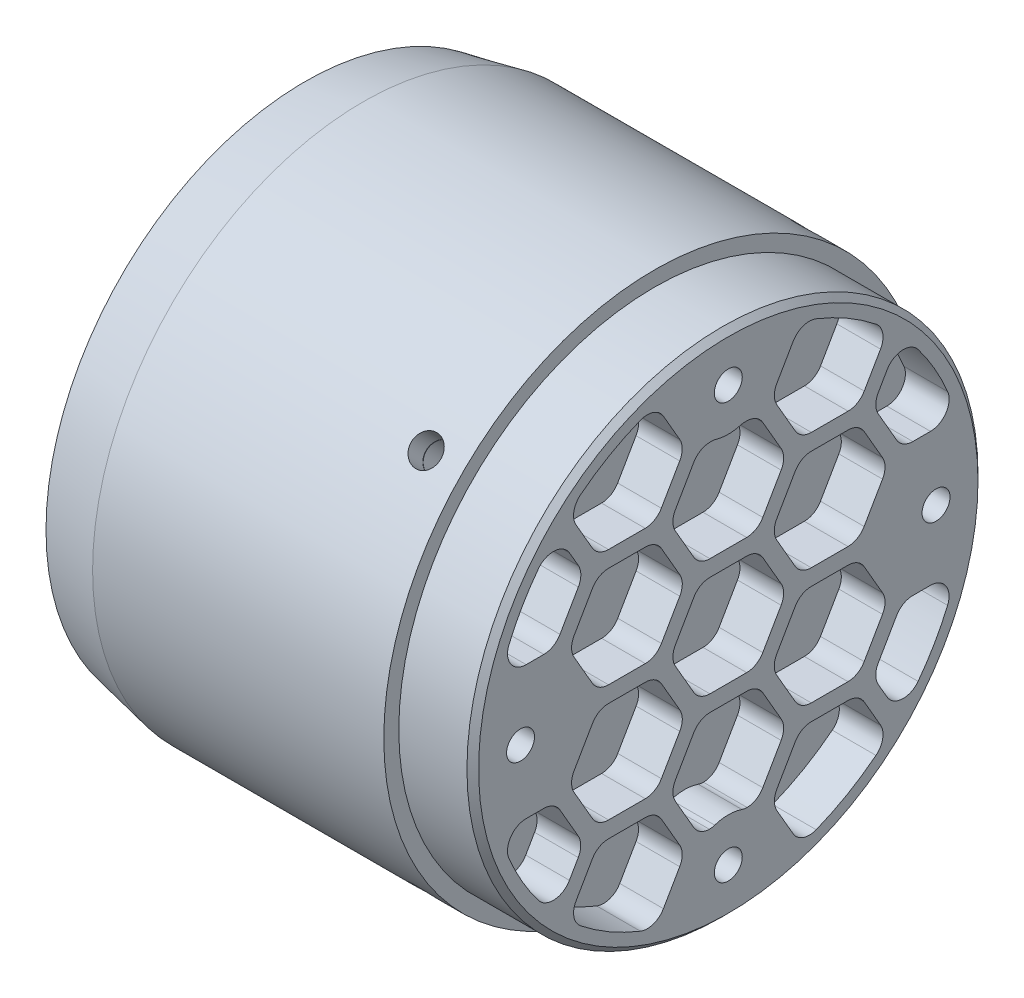
from build123d import *

# Parameters (mm, degrees)
SKETCH2_W               = 12.7
SKETCH2_H               = 14.195
SKETCH3_R               = 2.45
CUT_EXTRUDE1_DEPTH      = 89.967437864
CUT_EXTRUDE2_REACH      = 129.183
CUT_EXTRUDE2_END_RADIUS = 28.575
SKETCH4_R               = 2.54
CIRPATTERN1_COUNT       = 4
CUT_EXTRUDE3_DEPTH      = 12.7
FILLET1_R               = 3.2
FILLET2_R               = 3.2
SKETCH6_R               = 43.875
SKETCH6_R_2             = 2.4
BOSS_EXTRUDE1_DEPTH     = 12.7
CHAMFER1_SIZE           = 1
CUT_EXTRUDE4_DEPTH      = 7.5
FILLET3_R               = 3.2
FILLET4_START           = 65.2
FILLET4_DEPTH           = 7.5


with BuildPart() as part:
    # Sketch1 → Revolve1 (revolve)
    with BuildSketch(Plane.XY, mode=Mode.PRIVATE) as revolve1_sk:
        Polygon((10, 46.45), (60, 46.45), (60, 44.45), (60, 42.85), (40, 42.85), (40, 44.45), (0, 44.45), align=None)
    revolve(revolve1_sk.sketch.rotate(Axis((0, 0, 0), (1, 0, 0)), 90), axis=Axis((0, 0, 0), (1, 0, 0)))


with BuildPart() as body_2:
    # Sketch2 → Revolve2 (revolve)
    with BuildSketch(Plane.XY, mode=Mode.PRIVATE) as revolve2_sk:
        with Locations((53.65, 35.6725)):
            Rectangle(SKETCH2_W, SKETCH2_H)
    revolve(revolve2_sk.sketch.rotate(Axis((0, 0, 0), (1, 0, 0)), 90), axis=Axis((0, 0, 0), (1, 0, 0)))

    # Sketch3 → Cut-Extrude1 (cut, through all)
    with BuildSketch(Plane(origin=(60, 0, 0), x_dir=(0, 0, -1), z_dir=(1, 0, 0))):
        with Locations((-35.6725, 0)):
            Circle(SKETCH3_R)
        with Locations((0, 35.6725)):
            Circle(SKETCH3_R)
        with Locations((35.6725, 0)):
            Circle(SKETCH3_R)
        with Locations((0, -35.6725)):
            Circle(SKETCH3_R)
    extrude(amount=-CUT_EXTRUDE1_DEPTH, mode=Mode.SUBTRACT)


with BuildPart() as cut_extrude2_tool:
    # Cut-Extrude2: up to this cylinder (the profile starts outside it)
    cut_extrude2_end = Plane(origin=(53.65, 0, 0), z_dir=(-1, 0, 0)) * Cylinder(CUT_EXTRUDE2_END_RADIUS, 316.516, mode=Mode.PRIVATE)
    # Sketch4 → Cut-Extrude2 (new, up to the surface)
    with BuildSketch(Plane(origin=(0, 32.845109986, 32.845109986), x_dir=(-1, 0, 0), z_dir=(0, 0.7071067811865464, 0.7071067811865488)), mode=Mode.PRIVATE) as cut_extrude2_sk1:
        with Locations(Location((-53.65, 0, 0), (0, 0, 90))):
            Circle(SKETCH4_R)
    cut_extrude2_tool1 = extrude(cut_extrude2_sk1.sketch, amount=-CUT_EXTRUDE2_REACH, mode=Mode.PRIVATE) - cut_extrude2_end
    cut_extrude2 = cut_extrude2_tool1.solids().sort_by_distance((53.65, 32.84511, 32.84511))[0]
    add(cut_extrude2)


with BuildPart() as part_1:
    add(part.part)

    # Cut-Extrude2: cut by cut_extrude2_tool
    add(cut_extrude2_tool.part, mode=Mode.SUBTRACT)


with BuildPart() as body_2_1:
    add(body_2.part)

    # Cut-Extrude2: cut by cut_extrude2_tool
    add(cut_extrude2_tool.part, mode=Mode.SUBTRACT)


with BuildPart() as cirpattern1_tool:
    # CirPattern1: Cut-Extrude2 ×4 about axis
    cirpattern1_axis = Axis((60, 0, 0), (-1, 0, 0))
    for i in range(1, CIRPATTERN1_COUNT):
        add(cut_extrude2.rotate(cirpattern1_axis, i * 360 / CIRPATTERN1_COUNT))


with BuildPart() as part_2:
    add(part_1.part)

    # CirPattern1: cut by cirpattern1_tool
    add(cirpattern1_tool.part, mode=Mode.SUBTRACT)

    # Fillet2
    # the kernel refuses this fillet: 3.2 mm, written as the material it adds along each edge
    with BuildSketch(Plane(origin=(40, 0, 0), x_dir=(0, 0, 1), z_dir=(0, 1, 0))) as fillet2_piece_1:
        with BuildLine():
            CenterArc((41.25, -2.771281292), FILLET2_R, 0, 60)
            Line((44.45, -2.771281292), (44.514, -2.771281292))
            Line((44.514, -2.771281292), (44.514, 0))
            Line((44.514, 0), (44.45, 0.064))
            ThreePointArc((44.45, 0.064), (43.65, 0.064), (42.882, 0.055425626))
            Line((42.882, 0.055425626), (42.85, 0))
        make_face()
    revolve(axis=Axis((40, 0, 0), (1, 0, 0)))


with BuildPart() as body_2_2:
    add(body_2_1.part)

    # CirPattern1: cut by cirpattern1_tool
    add(cirpattern1_tool.part, mode=Mode.SUBTRACT)

    # Sketch5 → Cut-Extrude3 (cut)
    with BuildSketch(Plane(origin=(60, 0, 0), x_dir=(0, 0, -1), z_dir=(1, 0, 0))):
        Polygon((-29.044411037, 18.437809319), (-18.437809319, 29.044411037), (-11.366741508, 21.973343225), (-21.973343225, 11.366741508), align=None)
    extrude(amount=-CUT_EXTRUDE3_DEPTH, mode=Mode.SUBTRACT)

    # Fillet1
    fillet1_edges = [body_2_2.edges().sort_by_distance(p)[0] for p in [
        (53.65, 14.193886438, 24.800488156),
        (53.65, 24.800488156, 14.193886438),
        (53.65, 29.044411037, 18.437809319),
        (53.65, 18.437809319, 29.044411037),
    ]]
    fillet(fillet1_edges, radius=FILLET1_R)


with BuildPart() as body_3:
    # Sketch6 → Boss-Extrude1 (new body)
    with BuildSketch(Plane(origin=(60, 0, 0), x_dir=(0, 0, -1), z_dir=(1, 0, 0))):
        Circle(SKETCH6_R)
        with Locations((0, 35.6725)):
            Circle(SKETCH6_R_2, mode=Mode.SUBTRACT)
        with Locations((35.6725, 0)):
            Circle(SKETCH6_R_2, mode=Mode.SUBTRACT)
        with Locations((0, -35.6725)):
            Circle(SKETCH6_R_2, mode=Mode.SUBTRACT)
        with Locations((-35.6725, 0)):
            Circle(SKETCH6_R_2, mode=Mode.SUBTRACT)
    extrude(amount=BOSS_EXTRUDE1_DEPTH)

    # Chamfer1
    chamfer1_edges = [body_3.edges().sort_by_distance(p)[0] for p in [
        (72.7, 0, 43.875),
    ]]
    chamfer(chamfer1_edges, length=CHAMFER1_SIZE)

    # Sketch7 → Cut-Extrude4 (cut)
    with BuildSketch(Plane(origin=(72.7, 0, 0), x_dir=(0, 0, -1), z_dir=(1, 0, 0))):
        with BuildLine():
            Line((5, 11.437286527), (10, 20.097540565))
            Line((10, 20.097540565), (5, 28.757794602))
            Line((5, 28.757794602), (2.403232968, 28.757794602))
            ThreePointArc((2.403232968, 28.757794602), (0, 28.359529942), (-2.403232968, 28.757794602))
            Line((-2.403232968, 28.757794602), (-5, 28.757794602))
            Line((-5, 28.757794602), (-10, 20.097540565))
            Line((-10, 20.097540565), (-5, 11.437286527))
            Line((-5, 11.437286527), (5, 11.437286527))
        make_face()
        with BuildLine():
            ThreePointArc((27.243141885, 30.472558889), (20.4375, 35.39878838), (12.768439173, 38.829532396))
            Line((12.768439173, 38.829532396), (12.418240981, 38.829532396))
            Line((12.418240981, 38.829532396), (7.418240981, 30.169278358))
            Line((7.418240981, 30.169278358), (12.418240981, 21.50902432))
            Line((12.418240981, 21.50902432), (22.418240981, 21.50902432))
            Line((22.418240981, 21.50902432), (27.418240981, 30.169278358))
            Line((27.418240981, 30.169278358), (27.243141885, 30.472558889))
        make_face()
        with BuildLine():
            Line((-12.418240981, 38.829532396), (-12.768439173, 38.829532396))
            ThreePointArc((-12.768439173, 38.829532396), (-20.4375, 35.39878838), (-27.243141885, 30.472558889))
            Line((-27.243141885, 30.472558889), (-27.418240981, 30.169278358))
            Line((-27.418240981, 30.169278358), (-22.418240981, 21.50902432))
            Line((-22.418240981, 21.50902432), (-12.418240981, 21.50902432))
            Line((-12.418240981, 21.50902432), (-7.418240981, 30.169278358))
            Line((-7.418240981, 30.169278358), (-12.418240981, 38.829532396))
        make_face()
        with BuildLine():
            ThreePointArc((39.24224894, 11.437286527), (35.404768154, 20.427139226), (29.542644975, 28.24885401))
            Line((29.542644975, 28.24885401), (24.836481962, 20.097540565))
            Line((24.836481962, 20.097540565), (29.836481962, 11.437286527))
            Line((29.836481962, 11.437286527), (39.24224894, 11.437286527))
        make_face()
        with BuildLine():
            Line((-24.823221664, 20.120508076), (-29.526105153, 28.266141221))
            ThreePointArc((-29.526105153, 28.266141221), (-35.392805573, 20.447859024), (-39.235547688, 11.460254038))
            Line((-39.235547688, 11.460254038), (-29.823221664, 11.460254038))
            Line((-29.823221664, 11.460254038), (-24.823221664, 20.120508076))
        make_face()
        with BuildLine():
            ThreePointArc((29.526105153, -28.266141221), (35.392805573, -20.447859024), (39.235547688, -11.460254038))
            Line((39.235547688, -11.460254038), (29.823221664, -11.460254038))
            Line((29.823221664, -11.460254038), (24.823221664, -20.120508076))
            Line((24.823221664, -20.120508076), (29.526105153, -28.266141221))
        make_face()
        with BuildLine():
            Line((-29.836481962, -11.437286527), (-39.24224894, -11.437286527))
            ThreePointArc((-39.24224894, -11.437286527), (-35.404768154, -20.427139226), (-29.542644975, -28.24885401))
            Line((-29.542644975, -28.24885401), (-24.836481962, -20.097540565))
            Line((-24.836481962, -20.097540565), (-29.836481962, -11.437286527))
        make_face()
        with BuildLine():
            ThreePointArc((12.768439173, -38.829532396), (20.4375, -35.39878838), (27.243141885, -30.472558889))
            Line((27.243141885, -30.472558889), (27.418240981, -30.169278358))
            Line((27.418240981, -30.169278358), (22.418240981, -21.50902432))
            Line((22.418240981, -21.50902432), (12.418240981, -21.50902432))
            Line((12.418240981, -21.50902432), (7.418240981, -30.169278358))
            Line((7.418240981, -30.169278358), (12.418240981, -38.829532396))
            Line((12.418240981, -38.829532396), (12.768439173, -38.829532396))
        make_face()
        with BuildLine():
            Line((-27.418240981, -30.169278358), (-27.243141885, -30.472558889))
            ThreePointArc((-27.243141885, -30.472558889), (-20.4375, -35.39878838), (-12.768439173, -38.829532396))
            Line((-12.768439173, -38.829532396), (-12.418240981, -38.829532396))
            Line((-12.418240981, -38.829532396), (-7.418240981, -30.169278358))
            Line((-7.418240981, -30.169278358), (-12.418240981, -21.50902432))
            Line((-12.418240981, -21.50902432), (-22.418240981, -21.50902432))
            Line((-22.418240981, -21.50902432), (-27.418240981, -30.169278358))
        make_face()
        with BuildLine():
            Line((-5, -28.757794602), (-2.772967592, -28.757794602))
            ThreePointArc((-2.772967592, -28.757794602), (0, -28.2225), (2.772967592, -28.757794602))
            Line((2.772967592, -28.757794602), (5, -28.757794602))
            Line((5, -28.757794602), (10, -20.097540565))
            Line((10, -20.097540565), (5, -11.437286527))
            Line((5, -11.437286527), (-5, -11.437286527))
            Line((-5, -11.437286527), (-10, -20.097540565))
            Line((-10, -20.097540565), (-5, -28.757794602))
        make_face()
        Polygon((5, -8.660254038), (10, 0), (5, 8.660254038), (-5, 8.660254038), (-10, 0), (-5, -8.660254038), align=None)
        Polygon((12.404980682, 1.388516244), (22.404980682, 1.388516244), (27.404980682, 10.048770282), (22.404980682, 18.70902432), (12.404980682, 18.70902432), (7.404980682, 10.048770282), align=None)
        Polygon((7.404980682, -10.048770282), (12.404980682, -18.70902432), (22.404980682, -18.70902432), (27.404980682, -10.048770282), (22.404980682, -1.388516244), (12.404980682, -1.388516244), align=None)
        Polygon((-12.404980682, -1.388516244), (-22.404980682, -1.388516244), (-27.404980682, -10.048770282), (-22.404980682, -18.70902432), (-12.404980682, -18.70902432), (-7.404980682, -10.048770282), align=None)
        Polygon((-7.404980682, 10.048770282), (-12.404980682, 18.70902432), (-22.404980682, 18.70902432), (-27.404980682, 10.048770282), (-22.404980682, 1.388516244), (-12.404980682, 1.388516244), align=None)
    extrude(amount=-CUT_EXTRUDE4_DEPTH, mode=Mode.SUBTRACT)

    # Fillet3
    # the kernel refuses this fillet: 3.2 mm, written as the material it adds along each edge
    with BuildSketch(Plane(origin=(72.7, 11.437286527, -39.24224894), x_dir=(0, 0.942317571083779, 0.3347201745141261), z_dir=(-1, 0, 0)), Plane(origin=(72.7, -28.266141221, -29.526105153), x_dir=(0, 0.7610349598303124, -0.6487108677339039), z_dir=(-1, 0, 0)), Plane(origin=(72.7, 28.266141221, 29.526105153), x_dir=(0, -0.7610349598303043, 0.6487108677339136), z_dir=(-1, 0, 0))) as fillet3_piece_1:
        with BuildLine():
            CenterArc((4.530660908, -3.194672636), FILLET3_R, 86.693419498, 112.862103307)
            Line((1.515244681, -4.265777194), (1.454936356, -4.287199286))
            Line((1.454936356, -4.287199286), (-0.060308325, -0.021422091))
            Line((-0.060308325, -0.021422091), (-0.003691436, 0.063893453))
            ThreePointArc((-0.003691436, 0.063893453), (2.357616354, 0.132048752), (4.718924144, 0.063893453))
            Line((4.718924144, 0.063893453), (4.715232708, 0))
        make_face()
    extrude(amount=7.5)
    with BuildSketch(Plane(origin=(72.7, 28.24885401, -29.542644975), x_dir=(0, -0.761439287216753, -0.6482362315412825), z_dir=(-1, 0, 0)), Plane(origin=(72.7, -11.460254038, -39.235547688), x_dir=(0, -0.9421086877765903, 0.3353076503986617), z_dir=(-1, 0, 0)), Plane(origin=(72.7, -28.24885401, 29.542644975), x_dir=(0, 0.7614392872167106, 0.648236231541332), z_dir=(-1, 0, 0)), Plane(origin=(72.7, 11.460254038, 39.235547688), x_dir=(0, 0.9421086877766495, -0.33530765039849575), z_dir=(-1, 0, 0))) as fillet3_piece_2:
        with BuildLine():
            CenterArc((4.533655052, 3.194665586), FILLET3_R, 160.408752913, 112.900015215)
            Line((1.518907251, 4.267650068), (1.458612295, 4.289109757))
            Line((1.458612295, 4.289109757), (-0.060294956, 0.02145969))
            Line((-0.060294956, 0.02145969), (-0.003693876, -0.063893312))
            ThreePointArc((-0.003693876, -0.063893312), (2.359174414, -0.132138799), (4.722042704, -0.063893312))
            Line((4.722042704, -0.063893312), (4.718348828, 0))
        make_face()
    extrude(amount=7.5)
    with BuildSketch(Plane(origin=(72.7, 20.097540565, -24.836481962), x_dir=(0, 0.8660254037844372, -0.5000000000000026), z_dir=(-1, 0, 0)), Plane(origin=(72.7, 11.437286527, -29.836481962), x_dir=(0, 0.8660254037844387, 0.4999999999999999), z_dir=(-1, 0, 0)), Plane(origin=(72.7, 21.50902432, -22.418240981), x_dir=(0, 0, 1), z_dir=(-1, 0, 0)), Plane(origin=(72.7, 21.50902432, -12.418240981), x_dir=(0, 0.8660254037844374, 0.5000000000000021), z_dir=(-1, 0, 0)), Plane(origin=(72.7, 30.169278358, -7.418240981), x_dir=(0, 0.8660254037844403, -0.4999999999999973), z_dir=(-1, 0, 0)), Plane(origin=(72.7, 1.388516244, -22.404980682), x_dir=(0, 0, 1), z_dir=(-1, 0, 0)), Plane(origin=(72.7, 10.048770282, -27.404980682), x_dir=(0, -0.8660254037844374, 0.5000000000000024), z_dir=(-1, 0, 0)), Plane(origin=(72.7, 18.70902432, -22.404980682), x_dir=(0, -0.8660254037844399, -0.4999999999999976), z_dir=(-1, 0, 0)), Plane(origin=(72.7, 18.70902432, -12.404980682), x_dir=(0, 0, -1), z_dir=(-1, 0, 0)), Plane(origin=(72.7, 10.048770282, -7.404980682), x_dir=(0, 0.8660254037844374, -0.5000000000000021), z_dir=(-1, 0, 0)), Plane(origin=(72.7, -10.048770282, -27.404980682), x_dir=(0, -0.866025403784439, 0.4999999999999995), z_dir=(-1, 0, 0)), Plane(origin=(72.7, -1.388516244, -12.404980682), x_dir=(0, 0, -1), z_dir=(-1, 0, 0)), Plane(origin=(72.7, -10.048770282, -7.404980682), x_dir=(0, 0.8660254037844382, -0.500000000000001), z_dir=(-1, 0, 0)), Plane(origin=(72.7, -18.70902432, -22.404980682), x_dir=(0, 0, 1), z_dir=(-1, 0, 0)), Plane(origin=(72.7, -18.70902432, -12.404980682), x_dir=(0, 0.8660254037844383, 0.5000000000000006), z_dir=(-1, 0, 0)), Plane(origin=(72.7, -11.460254038, -29.823221664), x_dir=(0, 0, -1), z_dir=(-1, 0, 0)), Plane(origin=(72.7, -20.120508076, -24.823221664), x_dir=(0, 0.8660254037844387, -0.4999999999999999), z_dir=(-1, 0, 0)), Plane(origin=(72.7, -21.50902432, -12.418240981), x_dir=(0, 0, -1), z_dir=(-1, 0, 0)), Plane(origin=(72.7, -30.169278358, -7.418240981), x_dir=(0, 0.8660254037844398, -0.49999999999999784), z_dir=(-1, 0, 0)), Plane(origin=(72.7, -20.097540565, -10), x_dir=(0, -0.8660254037844387, 0.5000000000000001), z_dir=(-1, 0, 0)), Plane(origin=(72.7, -11.437286527, -5), x_dir=(0, -0.8660254037843838, -0.500000000000095), z_dir=(-1, 0, 0)), Plane(origin=(72.7, -20.097540565, 10), x_dir=(0, 0.8660254037844057, -0.5000000000000571), z_dir=(-1, 0, 0)), Plane(origin=(72.7, -28.757794602, 5), x_dir=(0, 0.8660254037843825, 0.5000000000000973), z_dir=(-1, 0, 0)), Plane(origin=(72.7, -28.757794602, -5), x_dir=(0, 0, 1), z_dir=(-1, 0, 0)), Plane(origin=(72.7, -21.50902432, 22.418240981), x_dir=(0, 0, -1), z_dir=(-1, 0, 0)), Plane(origin=(72.7, -21.50902432, 12.418240981), x_dir=(0, -0.8660254037844376, -0.500000000000002), z_dir=(-1, 0, 0)), Plane(origin=(72.7, -30.169278358, 7.418240981), x_dir=(0, -0.8660254037844404, 0.49999999999999717), z_dir=(-1, 0, 0)), Plane(origin=(72.7, -1.388516244, 22.404980682), x_dir=(0, 0, -1), z_dir=(-1, 0, 0)), Plane(origin=(72.7, -10.048770282, 27.404980682), x_dir=(0, 0.8660254037844826, -0.49999999999992384), z_dir=(-1, 0, 0)), Plane(origin=(72.7, -18.70902432, 22.404980682), x_dir=(0, 0.8660254037844378, 0.5000000000000012), z_dir=(-1, 0, 0)), Plane(origin=(72.7, -18.70902432, 12.404980682), x_dir=(0, 0, 1), z_dir=(-1, 0, 0)), Plane(origin=(72.7, -10.048770282, 7.404980682), x_dir=(0, -0.866025403784439, 0.49999999999999944), z_dir=(-1, 0, 0)), Plane(origin=(72.7, 0, -10), x_dir=(0, -0.8660254037844384, 0.5000000000000006), z_dir=(-1, 0, 0)), Plane(origin=(72.7, 8.660254038, -5), x_dir=(0, -0.866025403784438, -0.500000000000001), z_dir=(-1, 0, 0)), Plane(origin=(72.7, -8.660254038, -5), x_dir=(0, 0, 1), z_dir=(-1, 0, 0)), Plane(origin=(72.7, -8.660254038, 5), x_dir=(0, 0.8660254037844374, 0.5000000000000023), z_dir=(-1, 0, 0)), Plane(origin=(72.7, 8.660254038, 5), x_dir=(0, 0, -1), z_dir=(-1, 0, 0)), Plane(origin=(72.7, 20.097540565, 10), x_dir=(0, 0.8660254037844384, -0.5000000000000006), z_dir=(-1, 0, 0)), Plane(origin=(72.7, 11.437286527, -5), x_dir=(0, 0, 1), z_dir=(-1, 0, 0)), Plane(origin=(72.7, 20.097540565, -10), x_dir=(0, -0.8660254037844399, 0.4999999999999977), z_dir=(-1, 0, 0)), Plane(origin=(72.7, 28.757794602, -5), x_dir=(0, -0.8660254037844374, -0.5000000000000021), z_dir=(-1, 0, 0)), Plane(origin=(72.7, 28.757794602, 5), x_dir=(0, 0, -1), z_dir=(-1, 0, 0)), Plane(origin=(72.7, 30.169278358, 7.418240981), x_dir=(0, -0.8660254037844399, 0.4999999999999978), z_dir=(-1, 0, 0)), Plane(origin=(72.7, 21.50902432, 12.418240981), x_dir=(0, 0, 1), z_dir=(-1, 0, 0)), Plane(origin=(72.7, 21.50902432, 22.418240981), x_dir=(0, 0.8660254037844366, 0.5000000000000033), z_dir=(-1, 0, 0)), Plane(origin=(72.7, 1.388516244, 22.404980682), x_dir=(0, 0.8660254037844448, 0.4999999999999894), z_dir=(-1, 0, 0)), Plane(origin=(72.7, 1.388516244, 12.404980682), x_dir=(0, 0, 1), z_dir=(-1, 0, 0)), Plane(origin=(72.7, 18.70902432, 12.404980682), x_dir=(0, -0.8660254037844447, -0.4999999999999895), z_dir=(-1, 0, 0)), Plane(origin=(72.7, 18.70902432, 22.404980682), x_dir=(0, 0, -1), z_dir=(-1, 0, 0)), Plane(origin=(72.7, 10.048770282, 27.404980682), x_dir=(0, 0.8660254037844334, -0.5000000000000092), z_dir=(-1, 0, 0)), Plane(origin=(72.7, 11.460254038, 29.823221664), x_dir=(0, 0, 1), z_dir=(-1, 0, 0)), Plane(origin=(72.7, 20.120508076, 24.823221664), x_dir=(0, -0.8660254037844393, 0.4999999999999991), z_dir=(-1, 0, 0))) as fillet3_piece_3:
        with BuildLine():
            CenterArc((FILLET3_R * 0.57735026919, FILLET3_R), FILLET3_R, 210, 60)
            Line((-FILLET3_R * 0.288675134595, FILLET3_R * 0.5), (-FILLET3_R * 0.305995642671, FILLET3_R * 0.49))
            Line((-FILLET3_R * 0.305995642671, FILLET3_R * 0.49), (-FILLET3_R * 0.0115470053838, -FILLET3_R * 0.02))
            Line((-FILLET3_R * 0.0115470053838, -FILLET3_R * 0.02), (FILLET3_R * 0.57735026919, -FILLET3_R * 0.02))
            Line((FILLET3_R * 0.57735026919, -FILLET3_R * 0.02), (FILLET3_R * 0.57735026919, 0))
        make_face()
    extrude(amount=12.118802154)
    with BuildSketch(Plane(origin=(72.7, 38.829532396, -12.418240981), x_dir=(0, 0, -1), z_dir=(-1, 0, 0)), Plane(origin=(72.7, -30.169278358, -27.418240981), x_dir=(0, -0.8660254037838313, 0.5000000000010519), z_dir=(-1, 0, 0)), Plane(origin=(72.7, -38.829532396, 12.418240981), x_dir=(0, 0, 1), z_dir=(-1, 0, 0))) as fillet3_piece_4:
        with BuildLine():
            CenterArc((2.178938143, 2.625968429), FILLET3_R, 210, 25.146418522)
            Line((-0.592343149, 1.025968429), (-0.647768775, 0.993968429))
            Line((-0.647768775, 0.993968429), (-0.055425626, -0.032))
            Line((-0.055425626, -0.032), (0, -0.064))
            ThreePointArc((0, -0.064), (0.175099096, -0.064), (0.313623393, -0.052519369))
            Line((0.313623393, -0.052519369), (0.350198192, 0))
        make_face()
    extrude(amount=10.461715744)
    with BuildSketch(Plane(origin=(72.7, 30.472558889, -27.243141885), x_dir=(0, 0.661684932637486, 0.7497820015981482), z_dir=(-1, 0, 0))) as fillet3_piece_5:
        with BuildLine():
            CenterArc((0.505764717, -3.199933667), FILLET3_R, 89.631083591, 15.545199282)
            Line((-0.331962308, -0.11153385), (-0.348716849, -0.049765853))
            ThreePointArc((-0.348716849, -0.049765853), (-0.186364373, 0.004900401), (-0.020383219, 0.060667326))
            Line((-0.020383219, 0.060667326), (-0.000412081, 0.063998673))
            ThreePointArc((-0.000412081, 0.063998673), (0.263184377, 0.0648473), (0.526780834, 0.063998673))
            Line((0.526780834, 0.063998673), (0.526368754, 0))
        make_face()
    extrude(amount=8.815921884)
    with BuildSketch(Plane(origin=(72.7, 1.388516244, -12.404980682), x_dir=(0, 0, -1), z_dir=(-1, 0, 0)), Plane(origin=(72.7, -1.388516244, -22.404980682), x_dir=(0, 0, 1), z_dir=(-1, 0, 0)), Plane(origin=(72.7, -21.50902432, -22.418240981), x_dir=(0, 0, 1), z_dir=(-1, 0, 0)), Plane(origin=(72.7, -11.437286527, 5), x_dir=(0, -0.8660254037844055, 0.5000000000000573), z_dir=(-1, 0, 0)), Plane(origin=(72.7, -1.388516244, 12.404980682), x_dir=(0, 0, 1), z_dir=(-1, 0, 0)), Plane(origin=(72.7, 0, 10), x_dir=(0, -0.8660254037844373, -0.5000000000000024), z_dir=(-1, 0, 0)), Plane(origin=(72.7, 11.437286527, 5), x_dir=(0, 0, -1), z_dir=(-1, 0, 0)), Plane(origin=(72.7, 10.048770282, 7.404980682), x_dir=(0, 0.8660254037844448, 0.4999999999999894), z_dir=(-1, 0, 0))) as fillet3_piece_6:
        with BuildLine():
            CenterArc((FILLET3_R * 0.57735026919, -FILLET3_R), FILLET3_R, 90, 60)
            Line((-FILLET3_R * 0.288675134595, -FILLET3_R * 0.5), (-FILLET3_R * 0.305995642671, -FILLET3_R * 0.49))
            Line((-FILLET3_R * 0.305995642671, -FILLET3_R * 0.49), (-FILLET3_R * 0.0115470053838, FILLET3_R * 0.02))
            Line((-FILLET3_R * 0.0115470053838, FILLET3_R * 0.02), (FILLET3_R * 0.57735026919, FILLET3_R * 0.02))
            Line((FILLET3_R * 0.57735026919, FILLET3_R * 0.02), (FILLET3_R * 0.57735026919, 0))
        make_face()
    extrude(amount=12.118802154)
    with BuildSketch(Plane(origin=(72.7, -38.829532396, -12.418240981), x_dir=(0, 0.8660254037844373, 0.5000000000000022), z_dir=(-1, 0, 0)), Plane(origin=(72.7, -30.169278358, 27.418240981), x_dir=(0, 0.8660254037844405, -0.499999999999997), z_dir=(-1, 0, 0))) as fillet3_piece_7:
        with BuildLine():
            CenterArc((1.184686297, 3.2), FILLET3_R, 244.853581478, 25.146418522)
            Line((-0.175099096, 0.303280531), (-0.202294804, 0.245346141))
            ThreePointArc((-0.202294804, 0.245346141), (-0.142975174, 0.119640265), (-0.055425626, -0.032))
            Line((-0.055425626, -0.032), (0, -0.064))
            Line((0, -0.064), (1.184686297, -0.064))
            Line((1.184686297, -0.064), (1.184686297, 0))
        make_face()
    extrude(amount=10.461715744)
    with BuildSketch(Plane(origin=(72.7, -28.757794602, -2.772967592), x_dir=(0, 0.342798768331908, 0.9394088590332363), z_dir=(-1, 0, 0))) as fillet3_piece_8:
        with BuildLine():
            CenterArc((0.569962507, 3.19841305), FILLET3_R, 249.952517813, 18.242960332)
            Line((-0.526993551, 0.192304702), (-0.548932672, 0.132182535))
            Line((-0.548932672, 0.132182535), (-0.021939121, -0.060122167))
            Line((-0.021939121, -0.060122167), (0.002015337, -0.063968261))
            ThreePointArc((0.002015337, -0.063968261), (0.234597828, -0.060305383), (0.467180318, -0.063968261))
            Line((0.467180318, -0.063968261), (0.469195655, 0))
        make_face()
    extrude(amount=8.902460564)
    with BuildSketch(Plane(origin=(72.7, -28.757794602, 2.772967592), x_dir=(0, 0, 1), z_dir=(-1, 0, 0))) as fillet3_piece_9:
        with BuildLine():
            CenterArc((0.560984226, 3.2), FILLET3_R, 251.757039668, 18.242960332)
            Line((-0.440766555, 0.160839693), (-0.460801571, 0.100056487))
            ThreePointArc((-0.460801571, 0.100056487), (-0.241055889, 0.023768435), (-0.023821467, -0.059401496))
            Line((-0.023821467, -0.059401496), (0, -0.064))
            Line((0, -0.064), (0.560984226, -0.064))
            Line((0.560984226, -0.064), (0.560984226, 0))
        make_face()
    extrude(amount=8.902460564)
    with BuildSketch(Plane(origin=(72.7, 28.757794602, 2.403232968), x_dir=(0, -0.2968552177971054, -0.954922499298573), z_dir=(-1, 0, 0))) as fillet3_piece_10:
        with BuildLine():
            CenterArc((0.489688338, 3.198828663), FILLET3_R, 252.73118225, 15.718513943)
            Line((-0.460248359, 0.143076665), (-0.479247093, 0.081961625))
            Line((-0.479247093, 0.081961625), (-0.018998734, -0.06111504))
            Line((-0.018998734, -0.06111504), (0.001731495, -0.063976573))
            ThreePointArc((0.001731495, -0.063976573), (0.201556802, -0.061272981), (0.40138211, -0.063976573))
            Line((0.40138211, -0.063976573), (0.403113604, 0))
        make_face()
    extrude(amount=8.704936419)
    with BuildSketch(Plane(origin=(72.7, 28.757794602, -2.403232968), x_dir=(0, 0, -1), z_dir=(-1, 0, 0))) as fillet3_piece_11:
        with BuildLine():
            CenterArc((0.481974568, 3.2), FILLET3_R, 254.281486057, 15.718513943)
            Line((-0.384942251, 0.119666377), (-0.402280587, 0.058059704))
            ThreePointArc((-0.402280587, 0.058059704), (-0.210660329, 0.00132224), (-0.020645223, -0.060578666))
            Line((-0.020645223, -0.060578666), (0, -0.064))
            Line((0, -0.064), (0.481974568, -0.064))
            Line((0.481974568, -0.064), (0.481974568, 0))
        make_face()
    extrude(amount=8.704936419)
    with BuildSketch(Plane(origin=(72.7, 30.472558889, 27.243141885), x_dir=(0, 0.6616849326374059, -0.7497820015982188), z_dir=(-1, 0, 0))) as fillet3_piece_12:
        with BuildLine():
            CenterArc((0.505764717, 3.199933667), FILLET3_R, 254.823717127, 15.545199282)
            Line((-0.331962308, 0.11153385), (-0.348716849, 0.049765853))
            ThreePointArc((-0.348716849, 0.049765853), (-0.186364373, -0.004900401), (-0.020383219, -0.060667326))
            Line((-0.020383219, -0.060667326), (-0.000412081, -0.063998673))
            ThreePointArc((-0.000412081, -0.063998673), (0.263184377, -0.0648473), (0.526780834, -0.063998673))
            Line((0.526780834, -0.063998673), (0.526368754, 0))
        make_face()
    extrude(amount=8.815921884)
    with BuildSketch(Plane(origin=(72.7, 38.829532396, 12.768439173), x_dir=(0, -1.0956455113084808e-12, -1.0), z_dir=(-1, 0, 0))) as fillet3_piece_13:
        with BuildLine():
            CenterArc((0.539711804, 3.194383288), FILLET3_R, 251.059585865, 15.545199282)
            Line((-0.498959133, 0.167642023), (-0.519732552, 0.107107198))
            ThreePointArc((-0.519732552, 0.107107198), (-0.27013264, 0.022350508), (-0.019992174, -0.060797311))
            Line((-0.019992174, -0.060797311), (0, -0.064))
            ThreePointArc((0, -0.064), (0.175099096, -0.064), (0.34640792, -0.063887666))
            Line((0.34640792, -0.063887666), (0.350198192, 0))
        make_face()
    extrude(amount=8.815921884)

    # Fillet4: read off the stored shape, not the designer's step
    # Fillet4 outline → Fillet4 (add)
    with BuildSketch(Plane.YZ.offset(FILLET4_START)):
        with BuildLine():
            ThreePointArc((38.661890372, 13.267398307), (38.335323634, 14.183391232), (37.987058288, 15.091356057))
            ThreePointArc((37.987058288, 15.091356057), (38.035764791, 12.859279315), (36.613147914, 11.138610804))
            Line((36.613147914, 11.138610804), (38.829532396, 12.418240981))
            ThreePointArc((38.829532396, 12.418240981), (38.774554261, 12.848513852), (38.661890372, 13.267398307))
        make_face()
        with BuildLine():
            ThreePointArc((27.952893876, 26.138610804), (30.154344957, 26.510298904), (32.063026867, 25.352079464))
            ThreePointArc((32.063026867, 25.352079464), (31.450838936, 26.107668513), (30.820849162, 26.848480067))
            ThreePointArc((30.820849162, 26.848480067), (30.514416527, 27.155492084), (30.169278358, 27.418240981))
            Line((30.169278358, 27.418240981), (27.952893876, 26.138610804))
        make_face()
        with BuildLine():
            ThreePointArc((-36.613147914, 11.138610804), (-38.035764791, 12.859279315), (-37.987058288, 15.091356057))
            ThreePointArc((-37.987058288, 15.091356057), (-38.425852454, 13.936265218), (-38.829532396, 12.768439173))
            ThreePointArc((-38.829532396, 12.768439173), (-38.368465428, 12.240655909), (-37.803563967, 11.825897832))
            Line((-37.803563967, 11.825897832), (-36.613147914, 11.138610804))
        make_face()
        with BuildLine():
            ThreePointArc((-32.063026867, 25.352079464), (-30.154344957, 26.510298904), (-27.952893876, 26.138610804))
            Line((-27.952893876, 26.138610804), (-29.143309929, 26.825897832))
            ThreePointArc((-29.143309929, 26.825897832), (-29.78495169, 27.10773781), (-30.472558889, 27.243141885))
            ThreePointArc((-30.472558889, 27.243141885), (-31.28208594, 26.309631778), (-32.063026867, 25.352079464))
        make_face()
        with BuildLine():
            Line((-20.097540565, 24.836481962), (-18.497540565, 25.760242393))
            ThreePointArc((-18.497540565, 25.760242393), (-20.097540565, 25.331523685), (-21.697540565, 25.760242393))
            Line((-21.697540565, 25.760242393), (-20.097540565, 24.836481962))
        make_face()
        with BuildLine():
            Line((-11.437286527, 29.836481962), (-11.437286527, 31.684002824))
            ThreePointArc((-11.437286527, 31.684002824), (-11.866005235, 30.084002824), (-13.037286527, 28.912721532))
            Line((-13.037286527, 28.912721532), (-11.437286527, 29.836481962))
        make_face()
        with BuildLine():
            ThreePointArc((-15.880533159, 37.663965426), (-12.867878324, 37.381656471), (-11.437286527, 34.715349172))
            Line((-11.437286527, 34.715349172), (-11.437286527, 39.24224894))
            ThreePointArc((-11.437286527, 39.24224894), (-13.681687133, 38.517230718), (-15.880533159, 37.663965426))
        make_face()
        with BuildLine():
            ThreePointArc((-27.952893876, -26.138610804), (-30.154344957, -26.510298904), (-32.063026867, -25.352079464))
            ThreePointArc((-32.063026867, -25.352079464), (-31.28208594, -26.309631778), (-30.472558889, -27.243141885))
            ThreePointArc((-30.472558889, -27.243141885), (-29.78495169, -27.10773781), (-29.143309929, -26.825897832))
            Line((-29.143309929, -26.825897832), (-27.952893876, -26.138610804))
        make_face()
        with BuildLine():
            ThreePointArc((-37.987058288, -15.091356057), (-38.035764791, -12.859279315), (-36.613147914, -11.138610804))
            Line((-36.613147914, -11.138610804), (-37.803563967, -11.825897832))
            ThreePointArc((-37.803563967, -11.825897832), (-38.368465428, -12.240655909), (-38.829532396, -12.768439173))
            ThreePointArc((-38.829532396, -12.768439173), (-38.425852454, -13.936265218), (-37.987058288, -15.091356057))
        make_face()
        with BuildLine():
            ThreePointArc((30.820849162, -26.848480067), (31.450838936, -26.107668513), (32.063026867, -25.352079464))
            ThreePointArc((32.063026867, -25.352079464), (30.154344957, -26.510298904), (27.952893876, -26.138610804))
            Line((27.952893876, -26.138610804), (30.169278358, -27.418240981))
            ThreePointArc((30.169278358, -27.418240981), (30.514416527, -27.155492084), (30.820849162, -26.848480067))
        make_face()
        with BuildLine():
            ThreePointArc((36.613147914, -11.138610804), (38.035764791, -12.859279315), (37.987058288, -15.091356057))
            ThreePointArc((37.987058288, -15.091356057), (38.425852454, -13.936265218), (38.829532396, -12.768439173))
            ThreePointArc((38.829532396, -12.768439173), (38.368465428, -12.240655909), (37.803563967, -11.825897832))
            Line((37.803563967, -11.825897832), (36.613147914, -11.138610804))
        make_face()
    extrude(amount=FILLET4_DEPTH)


solid = Compound([part_2.part, body_2_2.part, body_3.part])
